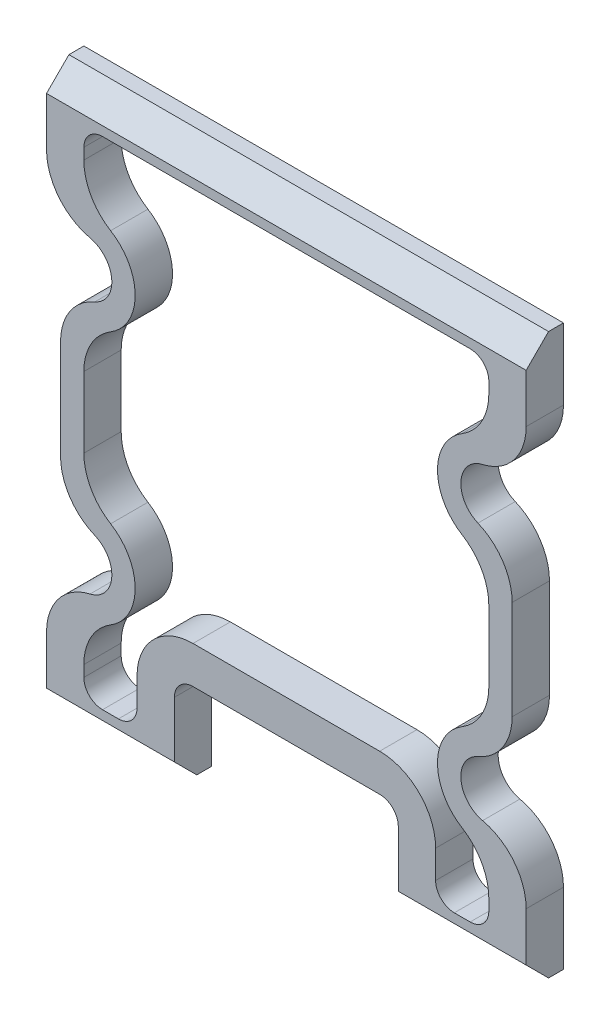
from build123d import *

# Parameters (mm, degrees)
BOSS_EXTRUDE1_DEPTH  = 2
SKETCH3_W            = 21.7
SKETCH3_H            = 0.5
BOSS_EXTRUDE2_DEPTH  = 2
SKETCH2_W            = 2
SKETCH2_H            = 3
CUT_EXTRUDE1_DEPTH   = 2
CHAMFER1_SIZE        = 2
CHAMFER3_SIZE        = 2
BOSS_EXTRUDE3_DEPTH  = 2
SKETCH5_W            = 2
SKETCH5_H            = 3
CUT_EXTRUDE2_DEPTH   = 10
SKETCH8_W            = 0.75
SKETCH8_H            = 10.6
CUT_EXTRUDE5_DEPTH   = 41.850764987
FILLET2_R            = 1
FILLET3_R            = 3
FILLET4_R            = 3
CUT_EXTRUDE4_START   = 30.85
CUT_EXTRUDE4_DEPTH   = 0.8
CUT_EXTRUDE4_START_2 = 0.05
CUT_EXTRUDE4_2_DEPTH = 0.8


# Read off the part's stored shape, not the designer's step: Cut-Extrude4
with BuildPart() as part:
    # Sketch1 → Boss-Extrude1 (new body)
    with BuildSketch(Plane.XY):
        with BuildLine():
            ThreePointArc((2.05, 7.55), (3.55, 9.05), (2.05, 10.55))
            Line((2.05, 10.55), (0.05, 10.55))
            Line((0.05, 10.55), (0.05, 31.65))
            Line((0.05, 31.65), (25.75, 31.65))
            Line((25.75, 31.65), (25.75, 0.05))
            Line((25.75, 0.05), (18.9, 0.05))
            Line((18.9, 0.05), (18.9, 6.05))
            Line((18.9, 6.05), (6.9, 6.05))
            Line((6.9, 6.05), (6.9, 0.05))
            Line((6.9, 0.05), (0.05, 0.05))
            Line((0.05, 0.05), (0.05, 7.55))
            Line((0.05, 7.55), (2.05, 7.55))
        make_face()
        with BuildLine():
            Line((2.05, 2.55), (2.05, 6.3))
            ThreePointArc((2.05, 6.3), (4.8, 9.05), (2.05, 11.8))
            Line((2.05, 11.8), (2.05, 29.65))
            Line((2.05, 29.65), (23.75, 29.65))
            Line((23.75, 29.65), (23.75, 2.55))
            Line((23.75, 2.55), (20.9, 2.55))
            Line((20.9, 2.55), (20.9, 8.05))
            Line((20.9, 8.05), (4.9, 8.05))
            Line((4.9, 8.05), (4.9, 2.55))
            Line((4.9, 2.55), (2.05, 2.55))
        make_face(mode=Mode.SUBTRACT)
    boss_extrude1 = extrude(amount=BOSS_EXTRUDE1_DEPTH)

    # Mirror8: Boss-Extrude1 across plane
    add(boss_extrude1.mirror(Plane.ZY.offset(-12.9)))

    # Sketch3 → Boss-Extrude2 (add)
    with BuildSketch(Plane.XY.offset(2)):
        with Locations((12.9, 29.4)):
            Rectangle(SKETCH3_W, SKETCH3_H)
    extrude(amount=-BOSS_EXTRUDE2_DEPTH)

    # Sketch2 → Cut-Extrude1 (cut)
    with BuildSketch(Plane.XY.offset(2)):
        with Locations((1.05, 9.05)):
            Rectangle(SKETCH2_W, SKETCH2_H)
        with Locations((24.75, 9.05)):
            Rectangle(SKETCH2_W, SKETCH2_H)
    extrude(amount=-CUT_EXTRUDE1_DEPTH, mode=Mode.SUBTRACT)

    # Chamfer1
    chamfer1_edges = [part.edges().sort_by_distance(p)[0] for p in [
        (22.325, 0.05, 2),
        (3.475, 0.05, 2),
    ]]
    chamfer(chamfer1_edges, length=CHAMFER1_SIZE - 0.0001)  # a hair under: the kernel refuses the full size

    # Chamfer3
    chamfer3_edges = [part.edges().sort_by_distance(p)[0] for p in [
        (12.9, 31.65, 2),
    ]]
    chamfer(chamfer3_edges, length=CHAMFER3_SIZE - 0.0001)  # a hair under: the kernel refuses the full size

    # Sketch4 → Boss-Extrude3 (add)
    with BuildSketch(Plane.XY.offset(2)):
        with BuildLine():
            ThreePointArc((2.05, 19.9), (4.8, 22.65), (2.05, 25.4))
            Line((2.05, 25.4), (2.05, 24.15))
            ThreePointArc((2.05, 24.15), (3.55, 22.65), (2.05, 21.15))
            Line((2.05, 21.15), (2.05, 19.9))
        make_face()
        with BuildLine():
            Line((23.75, 24.15), (23.75, 25.4))
            ThreePointArc((23.75, 25.4), (21, 22.65), (23.75, 19.9))
            Line((23.75, 19.9), (23.75, 21.15))
            ThreePointArc((23.75, 21.15), (22.25, 22.65), (23.75, 24.15))
        make_face()
    extrude(amount=-BOSS_EXTRUDE3_DEPTH)

    # Sketch5 → Cut-Extrude2 (cut)
    with BuildSketch(Plane.XY.offset(2)):
        with Locations((1.05, 22.65)):
            Rectangle(SKETCH5_W, SKETCH5_H)
        with Locations((24.75, 22.65)):
            Rectangle(SKETCH5_W, SKETCH5_H)
    extrude(amount=-CUT_EXTRUDE2_DEPTH, mode=Mode.SUBTRACT)

    # Sketch8 → Cut-Extrude5 (cut, through all)
    with BuildSketch(Plane.XY.offset(2)):
        with Locations((25.375, 15.85)):
            Rectangle(SKETCH8_W, SKETCH8_H)
        with Locations((0.425, 15.85)):
            Rectangle(SKETCH8_W, SKETCH8_H)
    extrude(amount=-CUT_EXTRUDE5_DEPTH, mode=Mode.SUBTRACT)

    # Fillet2
    fillet2_edges = [part.edges().sort_by_distance(p)[0] for p in [
        (2.05, 29.15, 1),
        (23.75, 29.15, 1),
        (2.05, 2.55, 1),
        (4.9, 2.55, 1),
        (20.9, 2.55, 1),
        (23.75, 2.55, 1),
        (18.9, 6.05, 1),
        (6.9, 6.05, 1),
    ]]
    fillet(fillet2_edges, radius=FILLET2_R)

    # Fillet3
    fillet3_edges = [part.edges().sort_by_distance(p)[0] for p in [
        (23.75, 6.3, 1),
        (23.75, 11.8, 1),
        (25.75, 7.55, 1),
        (23.75, 25.4, 1),
        (23.75, 19.9, 1),
        (25.75, 24.15, 1),
        (2.05, 11.8, 1),
        (2.05, 6.3, 1),
        (0.05, 7.55, 1),
        (2.05, 19.9, 1),
        (2.05, 25.4, 1),
        (0.05, 24.15, 1),
        (0.8, 10.55, 1),
        (0.8, 21.15, 1),
        (25, 21.15, 1),
        (25, 10.55, 1),
    ]]
    fillet(fillet3_edges, radius=FILLET3_R)

    # Fillet4
    fillet4_edges = [part.edges().sort_by_distance(p)[0] for p in [
        (4.9, 8.05, 1),
        (20.9, 8.05, 1),
    ]]
    fillet(fillet4_edges, radius=FILLET4_R)

    # Cut-Extrude4 outline → Cut-Extrude4 (cut)
    with BuildSketch(Plane(origin=(0, 0, 0), x_dir=(1, 0, 0), z_dir=(0, 1, 0)).offset(CUT_EXTRUDE4_START)):
        Polygon((-1, 1), (-1, -2), (0.05, -2), (25.75, -2), (27, -2), (27, 1), align=None)
    extrude(amount=CUT_EXTRUDE4_DEPTH, mode=Mode.SUBTRACT)

    # Cut-Extrude4 2 outline → Cut-Extrude4 2 (cut)
    with BuildSketch(Plane(origin=(0, 0, 0), x_dir=(1, 0, 0), z_dir=(0, 1, 0)).offset(CUT_EXTRUDE4_START_2)):
        Polygon((6.9, -2), (6.9, 1), (-1, 1), (-1, -2), (0.05, -2), align=None)
        Polygon((18.9, 1), (18.9, -2), (25.75, -2), (27, -2), (27, 1), align=None)
    extrude(amount=CUT_EXTRUDE4_2_DEPTH, mode=Mode.SUBTRACT)


solid = part.part
